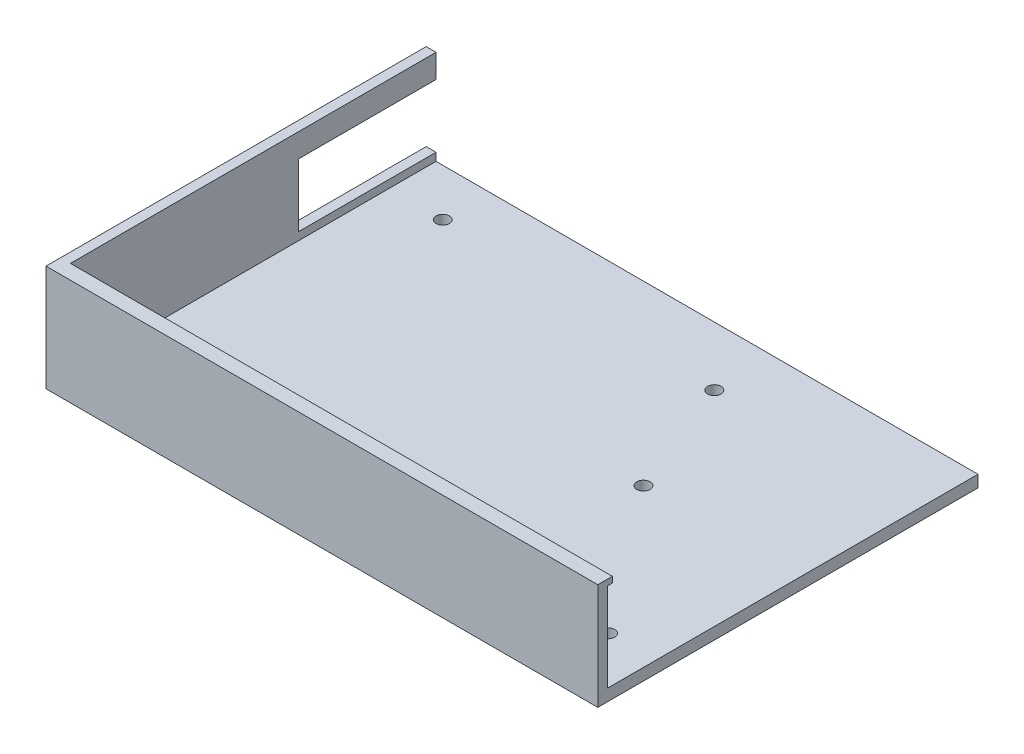
from build123d import *

# Parameters (mm, degrees)
SKETCH1_W                     = 280.4
SKETCH1_H                     = 193.2
SHELL_BLOCK_DEPTH             = 27
SKETCH2_W                     = 275.4
SKETCH2_H                     = 185.8
FRONT_OPENING_DEPTH           = 1.5
SKETCH3_W                     = 275.4
SKETCH3_H                     = 188.2
DISPLAY_POCKET_DEPTH          = 22.5
SKETCH4_W                     = 3
SKETCH4_H                     = 56
VENT_SLOTS_DEPTH              = 4
SKETCH5_W                     = 70
SKETCH5_H                     = 16
CABLE_EXIT_X_SHORT_SIDE_DEPTH = 141.2
SKETCH6_R                     = 1.7
BOLT_HOLES_DEPTH              = 4
KEEP_ONE_HALF_X_DEPTH         = 173.385034153
KEEP_ONE_HALF_X_DEPTH_BACK    = 173.385034153
SKETCH7_W                     = 200
SKETCH7_H                     = 400
KEEP_ONE_QUARTER_Z_DEPTH      = 173.385034153
KEEP_ONE_QUARTER_Z_DEPTH_BACK = 173.385034153
SKETCH8_W                     = 400
SKETCH8_H                     = 200


with BuildPart() as part:
    # Sketch1 → Shell Block (new body)
    with BuildSketch(Plane(origin=(0, 0, 0), x_dir=(1, 0, 0), z_dir=(0, 1, 0))):
        Rectangle(SKETCH1_W, SKETCH1_H)
    extrude(amount=SHELL_BLOCK_DEPTH)

    # Sketch2 → Front Opening (cut)
    with BuildSketch(Plane(origin=(0, 27, 0), x_dir=(1, 0, 0), z_dir=(0, 1, 0))):
        Rectangle(SKETCH2_W, SKETCH2_H)
    extrude(amount=-FRONT_OPENING_DEPTH, mode=Mode.SUBTRACT)

    # Sketch3 → Display Pocket (cut)
    with BuildSketch(Plane(origin=(0, 25.5, 0), x_dir=(1, 0, 0), z_dir=(0, 1, 0))):
        Rectangle(SKETCH3_W, SKETCH3_H)
    extrude(amount=-DISPLAY_POCKET_DEPTH, mode=Mode.SUBTRACT)

    # Sketch4 → Vent Slots (cut)
    with BuildSketch(Plane(origin=(0, 3, 0), x_dir=(1, 0, 0), z_dir=(0, 1, 0))):
        with Locations((67.5, 56)):
            Rectangle(SKETCH4_W, SKETCH4_H)
        with Locations((67.5, -56)):
            Rectangle(SKETCH4_W, SKETCH4_H)
        with Locations((75.5, 56)):
            Rectangle(SKETCH4_W, SKETCH4_H)
        with Locations((75.5, -56)):
            Rectangle(SKETCH4_W, SKETCH4_H)
        with Locations((83.5, 56)):
            Rectangle(SKETCH4_W, SKETCH4_H)
        with Locations((83.5, -56)):
            Rectangle(SKETCH4_W, SKETCH4_H)
        with Locations((91.5, 56)):
            Rectangle(SKETCH4_W, SKETCH4_H)
        with Locations((91.5, -56)):
            Rectangle(SKETCH4_W, SKETCH4_H)
        with Locations((99.5, 56)):
            Rectangle(SKETCH4_W, SKETCH4_H)
        with Locations((99.5, -56)):
            Rectangle(SKETCH4_W, SKETCH4_H)
        with Locations((107.5, 56)):
            Rectangle(SKETCH4_W, SKETCH4_H)
        with Locations((107.5, -56)):
            Rectangle(SKETCH4_W, SKETCH4_H)
        with Locations((115.5, 56)):
            Rectangle(SKETCH4_W, SKETCH4_H)
        with Locations((115.5, -56)):
            Rectangle(SKETCH4_W, SKETCH4_H)
        with Locations((123.5, 56)):
            Rectangle(SKETCH4_W, SKETCH4_H)
        with Locations((123.5, -56)):
            Rectangle(SKETCH4_W, SKETCH4_H)
    extrude(amount=-VENT_SLOTS_DEPTH, mode=Mode.SUBTRACT)

    # Sketch5 → Cable Exit (+X short side) (cut)
    with BuildSketch(Plane(origin=(0, 0, 0), x_dir=(0, 0, -1), z_dir=(1, 0, 0))):
        with Locations((0, 13)):
            Rectangle(SKETCH5_W, SKETCH5_H)
    extrude(amount=-CABLE_EXIT_X_SHORT_SIDE_DEPTH, mode=Mode.SUBTRACT)

    # Sketch6 → Bolt Holes (cut)
    with BuildSketch(Plane(origin=(0, 3, 0), x_dir=(1, 0, 0), z_dir=(0, 1, 0))):
        with Locations((-40, -45)):
            Circle(SKETCH6_R)
        with Locations((-40, 45)):
            Circle(SKETCH6_R)
        with Locations((40, -45)):
            Circle(SKETCH6_R)
        with Locations((40, 45)):
            Circle(SKETCH6_R)
        with Locations((-52, -15)):
            Circle(SKETCH6_R)
        with Locations((-52, 15)):
            Circle(SKETCH6_R)
        with Locations((52, -15)):
            Circle(SKETCH6_R)
        with Locations((52, 15)):
            Circle(SKETCH6_R)
        with Locations((-12, -82)):
            Circle(SKETCH6_R)
        with Locations((-12, 82)):
            Circle(SKETCH6_R)
        with Locations((12, -82)):
            Circle(SKETCH6_R)
        with Locations((12, 82)):
            Circle(SKETCH6_R)
        with Locations((-124, -12)):
            Circle(SKETCH6_R)
        with Locations((-124, 12)):
            Circle(SKETCH6_R)
        with Locations((124, -12)):
            Circle(SKETCH6_R)
        with Locations((124, 12)):
            Circle(SKETCH6_R)
    extrude(amount=-BOLT_HOLES_DEPTH, mode=Mode.SUBTRACT)

    # Sketch7 → Keep one half (X) (cut, two sides: drawn at the far end of the back side and taken through both)
    with BuildSketch(Plane(origin=(0, 0, 0), x_dir=(1, 0, 0), z_dir=(0, 1, 0)).offset(-KEEP_ONE_HALF_X_DEPTH_BACK)):
        with Locations((100, 0)):
            Rectangle(SKETCH7_W, SKETCH7_H)
    extrude(amount=KEEP_ONE_HALF_X_DEPTH + KEEP_ONE_HALF_X_DEPTH_BACK, mode=Mode.SUBTRACT)

    # Sketch8 → Keep one quarter (Z) (cut, two sides: drawn at the far end of the back side and taken through both)
    with BuildSketch(Plane(origin=(0, 0, 0), x_dir=(1, 0, 0), z_dir=(0, 1, 0)).offset(-KEEP_ONE_QUARTER_Z_DEPTH_BACK)):
        with Locations((0, 100)):
            Rectangle(SKETCH8_W, SKETCH8_H)
    extrude(amount=KEEP_ONE_QUARTER_Z_DEPTH + KEEP_ONE_QUARTER_Z_DEPTH_BACK, mode=Mode.SUBTRACT)


solid = part.part
